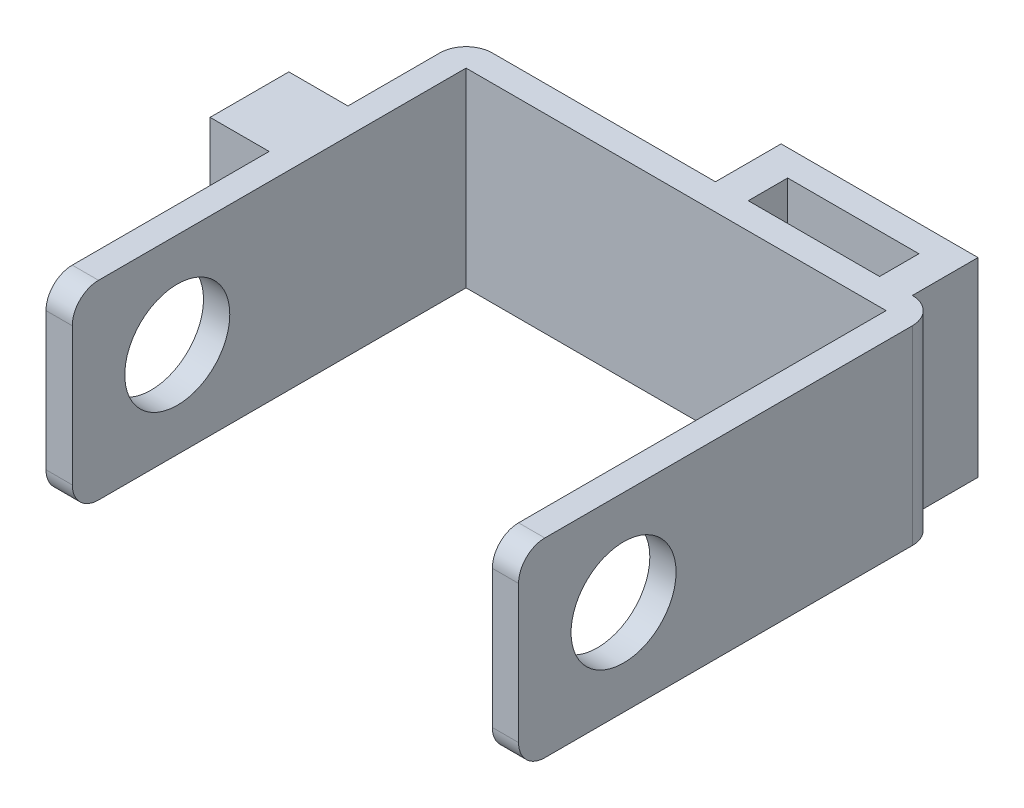
from build123d import *

# Parameters (mm, degrees)
EXTRUDE_1_DEPTH     = 14.5
SKETCH_2_W          = 10
SKETCH_2_H          = 3
CUT_EXTRUDE_1_DEPTH = 53.299617589
SKETCH_3_R          = 4
CUT_EXTRUDE_3_DEPTH = 40
FILLET_1_R          = 2
FILLET_2_R          = 2
FILLET_3_R          = 2
FILLET_4_R          = 2
FILLET_5_R          = 2
FILLET_6_R          = 2
SKETCH_5_W          = 6
SKETCH_5_H          = 14.5
EXTRUDE_2_DEPTH     = 4.5
SKETCH_6_W          = 2.5
SKETCH_6_H          = 6
CUT_EXTRUDE_4_DEPTH = 43.026777178


with BuildPart() as part:
    # Эскиз1 → Бобышка-Вытянуть1 (new body)
    with BuildSketch(Plane(origin=(0, 0, 0), x_dir=(1, 0, 0), z_dir=(0, 1, 0))):
        Polygon((0, 0), (-2, 0), (-2, 32), (17, 32), (17, 37), (32, 37), (32, 32), (34, 32), (34, 0), (32, 0), (32, 30), (0, 30), align=None)
    extrude(amount=EXTRUDE_1_DEPTH)

    # Эскиз2 → Вырез-Вытянуть1 (cut, through all)
    with BuildSketch(Plane(origin=(0, 14.5, 0), x_dir=(1, 0, 0), z_dir=(0, 1, 0))):
        with Locations((24.5, 33.5)):
            Rectangle(SKETCH_2_W, SKETCH_2_H)
    extrude(amount=-CUT_EXTRUDE_1_DEPTH, mode=Mode.SUBTRACT)

    # Эскиз3 → Вырез-Вытянуть3 (cut)
    with BuildSketch(Plane(origin=(34, 0, 0), x_dir=(0, 0, -1), z_dir=(1, 0, 0))):
        with Locations((8, 7.25)):
            Circle(SKETCH_3_R)
    extrude(amount=-CUT_EXTRUDE_3_DEPTH, mode=Mode.SUBTRACT)

    # Скругление1
    fillet_1_edges = [part.edges().sort_by_distance(p)[0] for p in [
        (34, 7.25, -32),
    ]]
    fillet(fillet_1_edges, radius=FILLET_1_R - 0.0001)  # a hair under: the kernel refuses the full size

    # Скругление2
    fillet_2_edges = [part.edges().sort_by_distance(p)[0] for p in [
        (-2, 7.25, -32),
    ]]
    fillet(fillet_2_edges, radius=FILLET_2_R)

    # Скругление3
    fillet_3_edges = [part.edges().sort_by_distance(p)[0] for p in [
        (-1, 14.5, 0),
    ]]
    fillet(fillet_3_edges, radius=FILLET_3_R)

    # Скругление4
    fillet_4_edges = [part.edges().sort_by_distance(p)[0] for p in [
        (33, 14.5, 0),
    ]]
    fillet(fillet_4_edges, radius=FILLET_4_R)

    # Скругление5
    fillet_5_edges = [part.edges().sort_by_distance(p)[0] for p in [
        (33, 0, 0),
    ]]
    fillet(fillet_5_edges, radius=FILLET_5_R)

    # Скругление6
    fillet_6_edges = [part.edges().sort_by_distance(p)[0] for p in [
        (-1, 0, 0),
    ]]
    fillet(fillet_6_edges, radius=FILLET_6_R)

    # Эскиз5 → Бобышка-Вытянуть2 (add)
    with BuildSketch(Plane.ZY.offset(2)):
        with Locations((-20, 7.25)):
            Rectangle(SKETCH_5_W, SKETCH_5_H)
    extrude(amount=EXTRUDE_2_DEPTH)

    # Эскиз6 → Вырез-Вытянуть4 (cut, through all)
    with BuildSketch(Plane.XY.offset(-17)):
        with Locations((-3.25, 7.25)):
            Rectangle(SKETCH_6_W, SKETCH_6_H)
    extrude(amount=-CUT_EXTRUDE_4_DEPTH, mode=Mode.SUBTRACT)


solid = part.part
